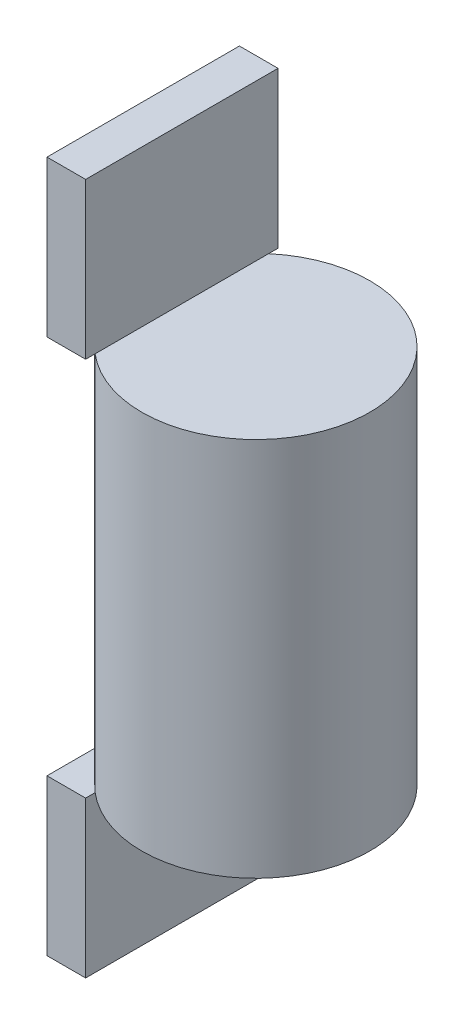
from build123d import *

# Parameters (mm, degrees)
SKETCH_1_R      = 3
EXTRUDE_1_DEPTH = 10
SKETCH_5_W      = 1.016865797
SKETCH_5_H      = 5.06336268
EXTRUDE_3_DEPTH = 4.1


with BuildPart() as part:
    # Эскиз1 → Бобышка-Вытянуть1 (new body)
    with BuildSketch(Plane(origin=(0, 0, 0), x_dir=(1, 0, 0), z_dir=(0, 1, 0))):
        Circle(SKETCH_1_R)
    extrude(amount=EXTRUDE_1_DEPTH)

    # Эскиз5 → Бобышка-Вытянуть3 (add)
    with BuildSketch(Plane(origin=(0, 10, 0), x_dir=(1, 0, 0), z_dir=(0, 1, 0))):
        with Locations((-2.455678484, 0)):
            Rectangle(SKETCH_5_W, SKETCH_5_H)
    extrude_3 = extrude(amount=EXTRUDE_3_DEPTH)

    # Зеркальное отражение1: Бобышка-Вытянуть3 across plane
    add(extrude_3.mirror(Plane.ZX.offset(5)))


solid = part.part
